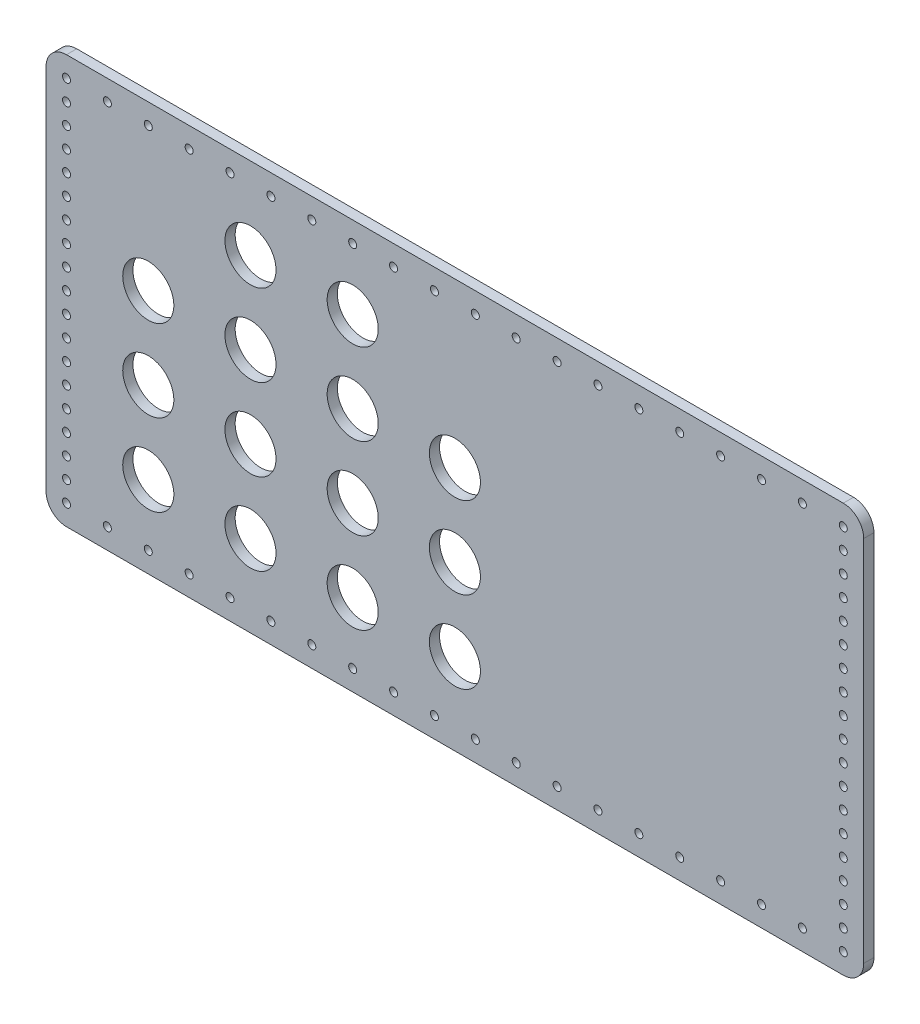
from build123d import *

# Parameters (mm, degrees)
SKETCH1_W           = 508
SKETCH1_H           = 254
BOSS_EXTRUDE1_DEPTH = 6.35
SKETCH3_R           = 15.875
CUT_EXTRUDE2_DEPTH  = 568.996762755
SKETCH4_R           = 2.4892
CUT_EXTRUDE3_DEPTH  = 568.996762755
FILLET1_R           = 12.7


with BuildPart() as part:
    # Sketch1 → Boss-Extrude1 (new body)
    with BuildSketch(Plane.XY):
        with Locations((254, 127)):
            Rectangle(SKETCH1_W, SKETCH1_H)
    extrude(amount=BOSS_EXTRUDE1_DEPTH)

    # Sketch3 → Cut-Extrude2 (cut, through all)
    with BuildSketch(Plane(origin=(0, 0, 0), x_dir=(-1, 0, 0), z_dir=(0, 0, -1))):
        with Locations((-127, 152.4)):
            Circle(SKETCH3_R)
        with Locations((-63.5, 152.4)):
            Circle(SKETCH3_R)
        with Locations((-190.5, 152.4)):
            Circle(SKETCH3_R)
        with Locations((-127, 101.6)):
            Circle(SKETCH3_R)
        with Locations((-63.5, 101.6)):
            Circle(SKETCH3_R)
        with Locations((-190.5, 101.6)):
            Circle(SKETCH3_R)
        with Locations((-127, 50.8)):
            Circle(SKETCH3_R)
        with Locations((-63.5, 50.8)):
            Circle(SKETCH3_R)
        with Locations((-190.5, 50.8)):
            Circle(SKETCH3_R)
        with Locations((-254, 152.4)):
            Circle(SKETCH3_R)
        with Locations((-254, 101.6)):
            Circle(SKETCH3_R)
        with Locations((-254, 50.8)):
            Circle(SKETCH3_R)
        with Locations((-190.5, 203.2)):
            Circle(SKETCH3_R)
        with Locations((-127, 203.2)):
            Circle(SKETCH3_R)
    extrude(amount=-CUT_EXTRUDE2_DEPTH, mode=Mode.SUBTRACT)

    # Sketch4 → Cut-Extrude3 (cut, through all)
    with BuildSketch(Plane(origin=(0, 0, 0), x_dir=(-1, 0, 0), z_dir=(0, 0, -1))):
        with Locations((-12.7, 241.3)):
            Circle(SKETCH4_R)
        with Locations((-38.1, 241.3)):
            Circle(SKETCH4_R)
        with Locations((-63.5, 241.3)):
            Circle(SKETCH4_R)
        with Locations((-88.9, 241.3)):
            Circle(SKETCH4_R)
        with Locations((-114.3, 241.3)):
            Circle(SKETCH4_R)
        with Locations((-139.7, 241.3)):
            Circle(SKETCH4_R)
        with Locations((-165.1, 241.3)):
            Circle(SKETCH4_R)
        with Locations((-190.5, 241.3)):
            Circle(SKETCH4_R)
        with Locations((-215.9, 241.3)):
            Circle(SKETCH4_R)
        with Locations((-241.3, 241.3)):
            Circle(SKETCH4_R)
        with Locations((-266.7, 241.3)):
            Circle(SKETCH4_R)
        with Locations((-292.1, 241.3)):
            Circle(SKETCH4_R)
        with Locations((-317.5, 241.3)):
            Circle(SKETCH4_R)
        with Locations((-342.9, 241.3)):
            Circle(SKETCH4_R)
        with Locations((-368.3, 241.3)):
            Circle(SKETCH4_R)
        with Locations((-393.7, 241.3)):
            Circle(SKETCH4_R)
        with Locations((-419.1, 241.3)):
            Circle(SKETCH4_R)
        with Locations((-444.5, 241.3)):
            Circle(SKETCH4_R)
        with Locations((-469.9, 241.3)):
            Circle(SKETCH4_R)
        with Locations((-495.3, 241.3)):
            Circle(SKETCH4_R)
        with Locations((-495.3, 228.6)):
            Circle(SKETCH4_R)
        with Locations((-12.7, 228.6)):
            Circle(SKETCH4_R)
        with Locations((-495.3, 215.9)):
            Circle(SKETCH4_R)
        with Locations((-12.7, 215.9)):
            Circle(SKETCH4_R)
        with Locations((-495.3, 203.2)):
            Circle(SKETCH4_R)
        with Locations((-12.7, 203.2)):
            Circle(SKETCH4_R)
        with Locations((-495.3, 190.5)):
            Circle(SKETCH4_R)
        with Locations((-12.7, 190.5)):
            Circle(SKETCH4_R)
        with Locations((-495.3, 177.8)):
            Circle(SKETCH4_R)
        with Locations((-12.7, 177.8)):
            Circle(SKETCH4_R)
        with Locations((-495.3, 165.1)):
            Circle(SKETCH4_R)
        with Locations((-12.7, 165.1)):
            Circle(SKETCH4_R)
        with Locations((-495.3, 152.4)):
            Circle(SKETCH4_R)
        with Locations((-12.7, 152.4)):
            Circle(SKETCH4_R)
        with Locations((-495.3, 139.7)):
            Circle(SKETCH4_R)
        with Locations((-12.7, 139.7)):
            Circle(SKETCH4_R)
        with Locations((-495.3, 127)):
            Circle(SKETCH4_R)
        with Locations((-12.7, 127)):
            Circle(SKETCH4_R)
        with Locations((-495.3, 114.3)):
            Circle(SKETCH4_R)
        with Locations((-12.7, 114.3)):
            Circle(SKETCH4_R)
        with Locations((-495.3, 101.6)):
            Circle(SKETCH4_R)
        with Locations((-12.7, 101.6)):
            Circle(SKETCH4_R)
        with Locations((-495.3, 88.9)):
            Circle(SKETCH4_R)
        with Locations((-12.7, 88.9)):
            Circle(SKETCH4_R)
        with Locations((-495.3, 76.2)):
            Circle(SKETCH4_R)
        with Locations((-12.7, 76.2)):
            Circle(SKETCH4_R)
        with Locations((-495.3, 63.5)):
            Circle(SKETCH4_R)
        with Locations((-12.7, 63.5)):
            Circle(SKETCH4_R)
        with Locations((-495.3, 50.8)):
            Circle(SKETCH4_R)
        with Locations((-12.7, 50.8)):
            Circle(SKETCH4_R)
        with Locations((-495.3, 38.1)):
            Circle(SKETCH4_R)
        with Locations((-12.7, 38.1)):
            Circle(SKETCH4_R)
        with Locations((-495.3, 25.4)):
            Circle(SKETCH4_R)
        with Locations((-12.7, 25.4)):
            Circle(SKETCH4_R)
        with Locations((-495.3, 12.7)):
            Circle(SKETCH4_R)
        with Locations((-12.7, 12.7)):
            Circle(SKETCH4_R)
        with Locations((-469.9, 12.7)):
            Circle(SKETCH4_R)
        with Locations((-444.5, 12.7)):
            Circle(SKETCH4_R)
        with Locations((-419.1, 12.7)):
            Circle(SKETCH4_R)
        with Locations((-393.7, 12.7)):
            Circle(SKETCH4_R)
        with Locations((-368.3, 12.7)):
            Circle(SKETCH4_R)
        with Locations((-342.9, 12.7)):
            Circle(SKETCH4_R)
        with Locations((-317.5, 12.7)):
            Circle(SKETCH4_R)
        with Locations((-292.1, 12.7)):
            Circle(SKETCH4_R)
        with Locations((-266.7, 12.7)):
            Circle(SKETCH4_R)
        with Locations((-241.3, 12.7)):
            Circle(SKETCH4_R)
        with Locations((-215.9, 12.7)):
            Circle(SKETCH4_R)
        with Locations((-190.5, 12.7)):
            Circle(SKETCH4_R)
        with Locations((-165.1, 12.7)):
            Circle(SKETCH4_R)
        with Locations((-139.7, 12.7)):
            Circle(SKETCH4_R)
        with Locations((-114.3, 12.7)):
            Circle(SKETCH4_R)
        with Locations((-88.9, 12.7)):
            Circle(SKETCH4_R)
        with Locations((-63.5, 12.7)):
            Circle(SKETCH4_R)
        with Locations((-38.1, 12.7)):
            Circle(SKETCH4_R)
    extrude(amount=-CUT_EXTRUDE3_DEPTH, mode=Mode.SUBTRACT)

    # Fillet1
    fillet1_edges = [part.edges().sort_by_distance(p)[0] for p in [
        (508, 0, 3.175),
        (0, 0, 3.175),
        (0, 254, 3.175),
        (508, 254, 3.175),
    ]]
    fillet(fillet1_edges, radius=FILLET1_R)


solid = part.part
